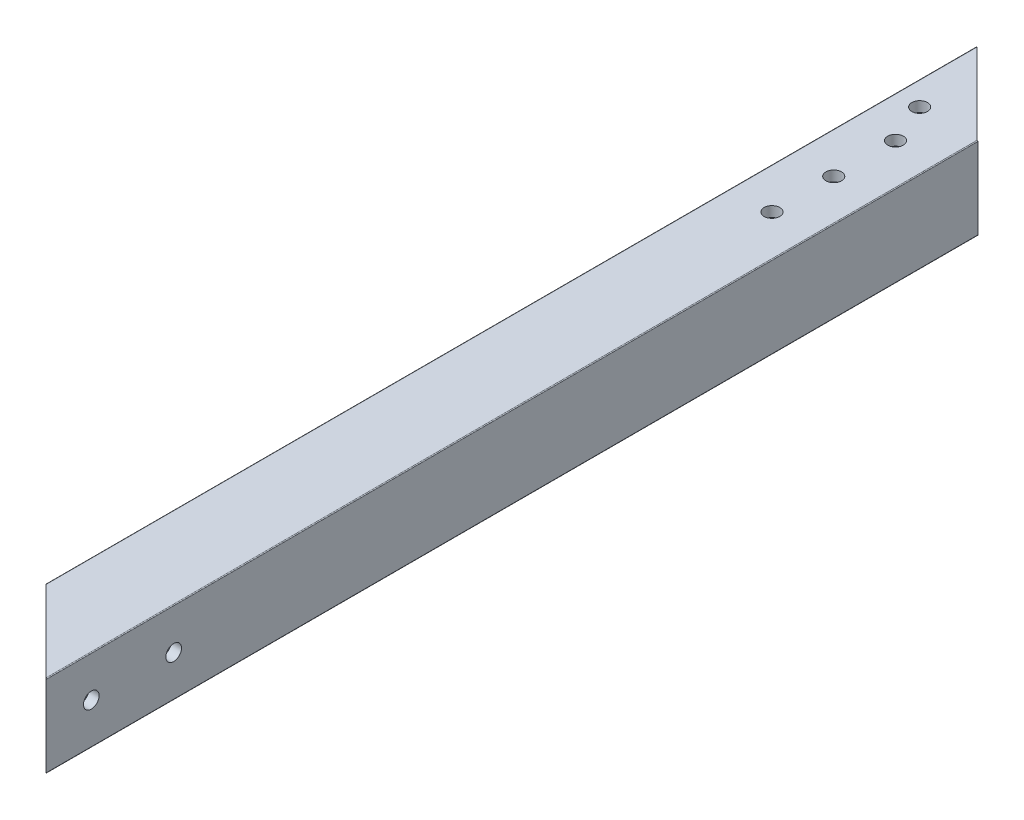
from build123d import *

# Parameters (mm, degrees)
CUT_EXTRUDE1_START = 1516.38
CUT_EXTRUDE1_DEPTH = 312.42
CUT_EXTRUDE2_REACH = 1831.153
CUT_EXTRUDE3_REACH = 1831.153
SKETCH5_R          = 2.413
CUT_EXTRUDE5_DEPTH = 1830.152743759
CUT_EXTRUDE7_REACH = 1831.153
SKETCH8_R          = 2.413
CUT_EXTRUDE8_REACH = 1831.153
SKETCH9_R          = 2.413


with BuildPart() as part:
    # Cut-Extrude1: read off the stored shape, not the designer's step
    # Cut-Extrude1 outline → Cut-Extrude1 (new body)
    with BuildSketch(Plane.XY.offset(CUT_EXTRUDE1_START)):
        with BuildLine():
            Line((0, 25.146), (0, 0.254))
            ThreePointArc((0, 0.254), (0.074394878, 0.074394878), (0.254, 0))
            Line((0.254, 0), (25.146, 0))
            ThreePointArc((25.146, 0), (25.325605122, 0.074394878), (25.4, 0.254))
            Line((25.4, 0.254), (25.4, 25.146))
            ThreePointArc((25.4, 25.146), (25.325605122, 25.325605122), (25.146, 25.4))
            Line((25.146, 25.4), (0.254, 25.4))
            ThreePointArc((0.254, 25.4), (0.074394878, 25.325605122), (0, 25.146))
        make_face()
        with BuildLine():
            ThreePointArc((4.7625, 3.175), (3.639967985, 3.639967985), (3.175, 4.7625))
            Line((3.175, 4.7625), (3.175, 20.6375))
            ThreePointArc((3.175, 20.6375), (3.639967985, 21.760032015), (4.7625, 22.225))
            Line((4.7625, 22.225), (20.6375, 22.225))
            ThreePointArc((20.6375, 22.225), (21.760032015, 21.760032015), (22.225, 20.6375))
            Line((22.225, 20.6375), (22.225, 4.7625))
            ThreePointArc((22.225, 4.7625), (21.760032015, 3.639967985), (20.6375, 3.175))
            Line((20.6375, 3.175), (4.7625, 3.175))
        make_face(mode=Mode.SUBTRACT)
    extrude(amount=CUT_EXTRUDE1_DEPTH)

    # Cut-Extrude2: up to this face of the body (flat: up to its plane)
    cut_extrude2_end = Plane(part.part.faces().sort_by_distance((12.7, 0, 1672.59))[0])
    # Sketch2 → Cut-Extrude2 (cut, up to the picked face)
    with BuildSketch(Plane(origin=(0, 25.4, 0), x_dir=(1, 0, 0), z_dir=(0, 1, 0)), mode=Mode.PRIVATE) as cut_extrude2_sk1:
        Polygon((43.169380192, -1523.628355708), (25.20886795, -1541.58886795), (-10.712156534, -1505.667843466), (7.248355708, -1487.707331224), align=None)
    cut_extrude2_tool1 = split(extrude(cut_extrude2_sk1.sketch, amount=-CUT_EXTRUDE2_REACH, mode=Mode.PRIVATE), bisect_by=cut_extrude2_end, keep=Keep.BOTH, mode=Mode.PRIVATE)
    add(cut_extrude2_tool1.solids().sort_by(Axis((16.228612, 25.4, 1514.6481), (0, -1, 0)))[0], mode=Mode.SUBTRACT)

    # Cut-Extrude3: up to this face of the body (flat: up to its plane)
    cut_extrude3_end = Plane(part.part.faces().sort_by_distance((12.527724859, 0, 1678.853862429))[0])
    # Sketch3 → Cut-Extrude3 (cut, up to the picked face)
    with BuildSketch(Plane(origin=(0, 25.4, 0), x_dir=(1, 0, 0), z_dir=(0, 1, 0)), mode=Mode.PRIVATE) as cut_extrude3_sk1:
        Polygon((34.192766306, -1837.592766306), (16.232254064, -1855.553278548), (-19.688770421, -1819.632254064), (-1.728258178, -1801.671741822), align=None)
    cut_extrude3_tool1 = split(extrude(cut_extrude3_sk1.sketch, amount=-CUT_EXTRUDE3_REACH, mode=Mode.PRIVATE), bisect_by=cut_extrude3_end, keep=Keep.BOTH, mode=Mode.PRIVATE)
    add(cut_extrude3_tool1.solids().sort_by(Axis((7.251998, 25.4, 1828.61251), (0, -1, 0)))[0], mode=Mode.SUBTRACT)

    # Sketch5 → Cut-Extrude5 (cut, through all)
    with BuildSketch(Plane.XZ):
        with Locations(Location((7.439487758, 1541.431804126, 0), (0, 0, 270))):
            Circle(SKETCH5_R)
        with Locations(Location((12.7, 1554.131804126, 0), (0, 0, 270))):
            Circle(SKETCH5_R)
        with Locations(Location((12.7, 1573.181804126, 0), (0, 0, 270))):
            Circle(SKETCH5_R)
        with Locations(Location((12.7, 1592.231804126, 0), (0, 0, 270))):
            Circle(SKETCH5_R)
    extrude(amount=-CUT_EXTRUDE5_DEPTH, mode=Mode.SUBTRACT)

    # Sketch8 → Cut-Extrude7 (cut, up to next)
    with BuildSketch(Plane(origin=(25.4, 0, 0), x_dir=(0, 0, -1), z_dir=(1, 0, 0)), mode=Mode.PRIVATE) as cut_extrude7_sk1:
        with Locations((-1814.83, 12.7)):
            Circle(SKETCH8_R)
    cut_extrude7_tool1 = extrude(cut_extrude7_sk1.sketch, amount=-CUT_EXTRUDE7_REACH, mode=Mode.PRIVATE) & part.part
    # Sketch8 → Cut-Extrude7 (cut, up to next)
    with BuildSketch(Plane(origin=(25.4, 0, 0), x_dir=(0, 0, -1), z_dir=(1, 0, 0)), mode=Mode.PRIVATE) as cut_extrude7_sk2:
        with Locations((-1789.43, 12.7)):
            Circle(SKETCH8_R)
    cut_extrude7_tool2 = extrude(cut_extrude7_sk2.sketch, amount=-CUT_EXTRUDE7_REACH, mode=Mode.PRIVATE) & part.part
    add(cut_extrude7_tool1.solids().sort_by_distance((25.4, 12.7, 1814.83))[0], mode=Mode.SUBTRACT)
    add(cut_extrude7_tool2.solids().sort_by_distance((25.4, 12.7, 1789.43))[0], mode=Mode.SUBTRACT)

    # Sketch9 → Cut-Extrude8 (cut, up to next)
    with BuildSketch(Plane.XZ, mode=Mode.PRIVATE) as cut_extrude8_sk1:
        with Locations(Location((12.7, 1789.159231637, 0), (0, 0, 270))):
            Circle(SKETCH9_R)
    cut_extrude8_tool1 = extrude(cut_extrude8_sk1.sketch, amount=-CUT_EXTRUDE8_REACH, mode=Mode.PRIVATE) & part.part
    # Sketch9 → Cut-Extrude8 (cut, up to next)
    with BuildSketch(Plane.XZ, mode=Mode.PRIVATE) as cut_extrude8_sk2:
        with Locations(Location((12.7, 1712.959231637, 0), (0, 0, 270))):
            Circle(SKETCH9_R)
    cut_extrude8_tool2 = extrude(cut_extrude8_sk2.sketch, amount=-CUT_EXTRUDE8_REACH, mode=Mode.PRIVATE) & part.part
    # Sketch9 → Cut-Extrude8 (cut, up to next)
    with BuildSketch(Plane.XZ, mode=Mode.PRIVATE) as cut_extrude8_sk3:
        with Locations(Location((12.7, 1636.759231637, 0), (0, 0, 270))):
            Circle(SKETCH9_R)
    cut_extrude8_tool3 = extrude(cut_extrude8_sk3.sketch, amount=-CUT_EXTRUDE8_REACH, mode=Mode.PRIVATE) & part.part
    add(cut_extrude8_tool1.solids().sort_by_distance((12.7, 0, 1789.159232))[0], mode=Mode.SUBTRACT)
    add(cut_extrude8_tool2.solids().sort_by_distance((12.7, 0, 1712.959232))[0], mode=Mode.SUBTRACT)
    add(cut_extrude8_tool3.solids().sort_by_distance((12.7, 0, 1636.759232))[0], mode=Mode.SUBTRACT)


solid = part.part
